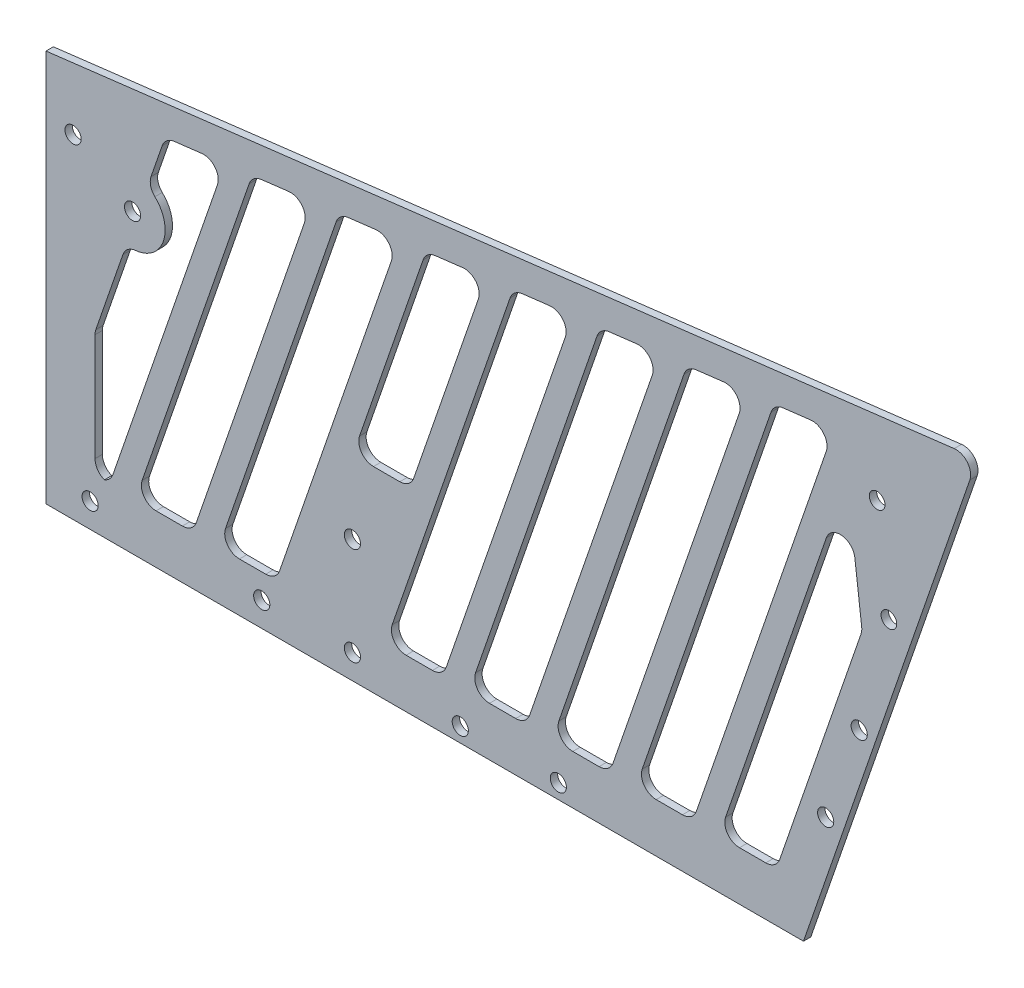
from build123d import *

# Parameters (mm, degrees)
SKETCH_1_R          = 1.65
EXTRUDE_1_DEPTH     = 1.5
SKETCH_2_R          = 1.65
CUT_EXTRUDE_1_DEPTH = 217.113258134
SKETCH_5_R          = 1.6
CUT_EXTRUDE_3_DEPTH = 217.113258134
CUT_EXTRUDE_4_DEPTH = 10
FILLET_3_R          = 3
FILLET_4_R          = 5
SKETCH_7_W          = 17
SKETCH_7_H          = 10
EXTRUDE_2_DEPTH     = 1.5
FILLET_5_R          = 3
FILLET_6_R          = 3


with BuildPart() as part:
    # 草图1 → 凸台-拉伸1 (new body)
    with BuildSketch(Plane.XY):
        Polygon((0, 0), (49, 0), (154.500036, 0), (190, 102.969366032), (0, 80), align=None)
        with Locations((44, 5)):
            Circle(SKETCH_1_R, mode=Mode.SUBTRACT)
        with Locations((9, 5)):
            Circle(SKETCH_1_R, mode=Mode.SUBTRACT)
        with Locations((62.500036, 5)):
            Circle(SKETCH_1_R, mode=Mode.SUBTRACT)
        with Locations((62.500036, 25)):
            Circle(SKETCH_1_R, mode=Mode.SUBTRACT)
        with Locations((84.500036, 3)):
            Circle(SKETCH_1_R, mode=Mode.SUBTRACT)
        with Locations((104.500036, 3)):
            Circle(SKETCH_1_R, mode=Mode.SUBTRACT)
        with Locations((159.029214579, 24.172402674)):
            Circle(SKETCH_1_R, mode=Mode.SUBTRACT)
        with Locations((165.869617446, 42.96625509)):
            Circle(SKETCH_1_R, mode=Mode.SUBTRACT)
        with Locations((5.51669804, 68)):
            Circle(SKETCH_1_R, mode=Mode.SUBTRACT)
    extrude(amount=EXTRUDE_1_DEPTH)

    # 草图2 → 切除-拉伸1 (cut, through all)
    with BuildSketch(Plane(origin=(0, 0, 0), x_dir=(-1, 0, 0), z_dir=(0, 0, -1))):
        with Locations((-17.654838092, 60.522562577)):
            Circle(SKETCH_2_R)
    extrude(amount=-CUT_EXTRUDE_1_DEPTH, mode=Mode.SUBTRACT)

    # 草图5 → 切除-拉伸3 (cut, through all)
    with BuildSketch(Plane.XY.offset(1.5)):
        with Locations((169.526207601, 85.385047705)):
            Circle(SKETCH_5_R)
        with Locations((171.926558982, 65.529612347)):
            Circle(SKETCH_5_R)
    extrude(amount=-CUT_EXTRUDE_3_DEPTH, mode=Mode.SUBTRACT)

    # 草图6 → 切除-拉伸4 (cut)
    with BuildSketch(Plane(origin=(0, 0, 0), x_dir=(-1, 0, 0), z_dir=(0, 0, -1))):
        Polygon((-166.458788313, 60.765712768), (-148.956680209, 10), (-137.24549175, 10), (-163.418370686, 85.91570378), align=None)
        Polygon((-160.704378524, 93.384092174), (-131.956680209, 10), (-120.24549175, 10), (-148.483853144, 91.90673575), align=None)
        Polygon((-142.96502336, 91.23955669), (-114.956680209, 10), (-103.24549175, 10), (-130.74449798, 89.762200266), align=None)
        Polygon((-125.225668197, 89.095021206), (-97.956680209, 10), (-86.24549175, 10), (-113.005142817, 87.617664782), align=None)
        Polygon((-107.486313033, 86.950485723), (-80.956680209, 10), (-69.24549175, 10), (-95.265787653, 85.473129299), align=None)
        with BuildLine():
            Line((-77.526432489, 83.328593815), (-89.746957869, 84.805950239))
            Line((-89.746957869, 84.805950239), (-69.149740199, 25.062722173))
            ThreePointArc((-69.149740199, 25.062722173), (-65.935444688, 30.69389736), (-59.455145067, 30.91194885))
            Line((-59.455145067, 30.91194885), (-77.526432489, 83.328593815))
        make_face()
        with BuildLine():
            Line((-12.956680209, 10), (-10, 10))
            Line((-10, 10), (-10, 35.392875452))
            Line((-10, 35.392875452), (-16.411528112, 53.989823466))
            ThreePointArc((-16.411528112, 53.989823466), (-23.94169474, 58.355090898), (-20.701647581, 66.4335229))
            Line((-20.701647581, 66.4335229), (-24.308366998, 76.894987363))
            Line((-24.308366998, 76.894987363), (-36.528892378, 78.372343787))
            Line((-36.528892378, 78.372343787), (-12.956680209, 10))
        make_face()
        Polygon((-72.007602706, 82.661414755), (-46.956680209, 10), (-35.24549175, 10), (-59.787077326, 81.184058331), align=None)
        Polygon((-29.956680209, 10), (-18.24549175, 10), (-42.047722162, 79.039522847), (-54.268247542, 80.516879271), align=None)
    extrude(amount=-CUT_EXTRUDE_4_DEPTH, mode=Mode.SUBTRACT)

    # 圆角3
    # the kernel refuses this fillet: 3 mm, written as the material it adds along each edge
    with BuildSketch(Plane(origin=(89.746957869, 84.805950239, 0), x_dir=(-0.32593559085415924, -0.9453919772319576, 0), z_dir=(0, 0, 1)), Plane(origin=(107.486313033, 86.950485723, 0), x_dir=(-0.32593559085416013, -0.9453919772319572, 0), z_dir=(0, 0, 1)), Plane(origin=(54.268247542, 80.516879271, 0), x_dir=(-0.32593559085415885, -0.9453919772319577, 0), z_dir=(0, 0, 1)), Plane(origin=(125.225668197, 89.095021206, 0), x_dir=(-0.32593559085416013, -0.9453919772319572, 0), z_dir=(0, 0, 1)), Plane(origin=(142.96502336, 91.23955669, 0), x_dir=(-0.3259355908541637, -0.945391977231956, 0), z_dir=(0, 0, 1)), Plane(origin=(36.528892378, 78.372343787, 0), x_dir=(-0.32593559085416013, -0.9453919772319572, 0), z_dir=(0, 0, 1))) as fillet_3_piece_1:
        with BuildLine():
            CenterArc((FILLET_3_R * 1.59770807733, -FILLET_3_R), FILLET_3_R, 90, 115.915383649)
            Line((FILLET_3_R * 0.698267610033, -FILLET_3_R * 1.43704329967), (0, 0))
            Line((0, 0), (FILLET_3_R * 1.59770807733, 0))
        make_face()
    extrude(amount=1.5)
    with BuildSketch(Plane(origin=(77.526432489, 83.328593815, 0), x_dir=(-0.32593559085416024, -0.9453919772319572, 0), z_dir=(0, 0, 1))) as fillet_3_piece_2:
        with BuildLine():
            CenterArc((FILLET_3_R * 0.625896566582, FILLET_3_R), FILLET_3_R, 205.915383649, 64.084616351)
            Line((-FILLET_3_R * 0.273543900714, FILLET_3_R * 0.562956700325), (0, 0))
            Line((0, 0), (FILLET_3_R * 0.625896566582, 0))
        make_face()
    extrude(amount=1.5)
    with BuildSketch(Plane(origin=(95.265787653, 85.473129299, 0), x_dir=(0.9927717678876198, 0.12001756906924078, 0), z_dir=(0, 0, 1)), Plane(origin=(42.047722162, 79.039522847, 0), x_dir=(0.9927717678876197, 0.12001756906924214, 0), z_dir=(0, 0, 1)), Plane(origin=(59.787077326, 81.184058331, 0), x_dir=(0.9927717678876204, 0.12001756906923514, 0), z_dir=(0, 0, 1)), Plane(origin=(148.483853144, 91.90673575, 0), x_dir=(0.9927717678876198, 0.12001756906924078, 0), z_dir=(0, 0, 1)), Plane(origin=(113.005142817, 87.617664782, 0), x_dir=(0.9927717678876197, 0.12001756906924169, 0), z_dir=(0, 0, 1)), Plane(origin=(130.74449798, 89.762200266, 0), x_dir=(0.9927717678876193, 0.1200175690692444, 0), z_dir=(0, 0, 1)), Plane(origin=(24.308366998, 76.894987363, 0), x_dir=(0.9927717678876197, 0.12001756906924214, 0), z_dir=(0, 0, 1))) as fillet_3_piece_3:
        with BuildLine():
            CenterArc((FILLET_3_R * 0.625896566582, -FILLET_3_R), FILLET_3_R, 90, 64.084616351)
            Line((-FILLET_3_R * 0.273543900714, -FILLET_3_R * 0.562956700325), (0, 0))
            Line((0, 0), (FILLET_3_R * 0.625896566582, 0))
        make_face()
    extrude(amount=1.5)
    with BuildSketch(Plane(origin=(69.24549175, 10, 0), x_dir=(0.3259355908541607, 0.9453919772319569, 0), z_dir=(0, 0, 1)), Plane(origin=(35.24549175, 10, 0), x_dir=(0.3259355908541611, 0.9453919772319569, 0), z_dir=(0, 0, 1)), Plane(origin=(120.24549175, 10, 0), x_dir=(0.3259355908541582, 0.9453919772319579, 0), z_dir=(0, 0, 1)), Plane(origin=(137.24549175, 10, 0), x_dir=(0.3259355908541602, 0.9453919772319572, 0), z_dir=(0, 0, 1)), Plane(origin=(86.24549175, 10, 0), x_dir=(0.3259355908541607, 0.9453919772319569, 0), z_dir=(0, 0, 1)), Plane(origin=(103.24549175, 10, 0), x_dir=(0.3259355908541607, 0.9453919772319569, 0), z_dir=(0, 0, 1))) as fillet_3_piece_4:
        with BuildLine():
            CenterArc((FILLET_3_R * 1.40252469112, -FILLET_3_R), FILLET_3_R, 90, 109.022267108)
            Line((FILLET_3_R * 0.457132713888, -FILLET_3_R * 1.32593559085), (0, 0))
            Line((0, 0), (FILLET_3_R * 1.40252469112, 0))
        make_face()
    extrude(amount=1.5)
    with BuildSketch(Plane(origin=(80.956680209, 10, 0), x_dir=(0.32593559085415746, 0.9453919772319582, 0), z_dir=(0, 0, 1)), Plane(origin=(97.956680209, 10, 0), x_dir=(0.32593559085415946, 0.9453919772319574, 0), z_dir=(0, 0, 1)), Plane(origin=(114.956680209, 10, 0), x_dir=(0.3259355908541564, 0.9453919772319586, 0), z_dir=(0, 0, 1)), Plane(origin=(12.956680209, 10, 0), x_dir=(0.3259355908541589, 0.9453919772319578, 0), z_dir=(0, 0, 1))) as fillet_3_piece_5:
        with BuildLine():
            CenterArc((FILLET_3_R * 0.7129999253, FILLET_3_R), FILLET_3_R, 199.022267108, 70.977732892)
            Line((-FILLET_3_R * 0.232392051932, FILLET_3_R * 0.674064409146), (0, 0))
            Line((0, 0), (FILLET_3_R * 0.7129999253, 0))
        make_face()
    extrude(amount=1.5)
    with BuildSketch(Plane(origin=(18.24549175, 10, 0), x_dir=(1, 0, 0), z_dir=(0, 0, 1))) as fillet_3_piece_6:
        with BuildLine():
            CenterArc((FILLET_3_R * 1.40252469112, FILLET_3_R), FILLET_3_R, 160.977732892, 109.022267108)
            Line((FILLET_3_R * 0.457132713888, FILLET_3_R * 1.32593559085), (0, 0))
            Line((0, 0), (FILLET_3_R * 1.40252469112, 0))
        make_face()
    extrude(amount=1.5)
    with BuildSketch(Plane(origin=(29.956680209, 10, 0), x_dir=(-1, 0, 0), z_dir=(0, 0, 1)), Plane(origin=(46.956680209, 10, 0), x_dir=(-1, 0, 0), z_dir=(0, 0, 1)), Plane(origin=(131.956680209, 10, 0), x_dir=(-1, 0, 0), z_dir=(0, 0, 1)), Plane(origin=(148.956680209, 10, 0), x_dir=(-1, 0, 0), z_dir=(0, 0, 1))) as fillet_3_piece_7:
        with BuildLine():
            CenterArc((FILLET_3_R * 0.7129999253, -FILLET_3_R), FILLET_3_R, 90, 70.977732892)
            Line((-FILLET_3_R * 0.232392051932, -FILLET_3_R * 0.674064409146), (0, 0))
            Line((0, 0), (FILLET_3_R * 0.7129999253, 0))
        make_face()
    extrude(amount=1.5)
    with BuildSketch(Plane(origin=(72.007602706, 82.661414755, 0), x_dir=(-0.9927717678876198, -0.12001756906924071, 0), z_dir=(0, 0, 1)), Plane(origin=(160.704378524, 93.384092174, 0), x_dir=(-0.9927717678876197, -0.12001756906924108, 0), z_dir=(0, 0, 1))) as fillet_3_piece_8:
        with BuildLine():
            CenterArc((FILLET_3_R * 1.59770807733, FILLET_3_R), FILLET_3_R, 154.084616351, 115.915383649)
            Line((FILLET_3_R * 0.698267610033, FILLET_3_R * 1.43704329967), (0, 0))
            Line((0, 0), (FILLET_3_R * 1.59770807733, 0))
        make_face()
    extrude(amount=1.5)
    with BuildSketch(Plane(origin=(166.458788313, 60.765712768, 0), x_dir=(-0.3259355908541462, -0.9453919772319621, 0), z_dir=(0, 0, 1))) as fillet_3_piece_9:
        with BuildLine():
            CenterArc((FILLET_3_R * 0.230090548875, -FILLET_3_R), FILLET_3_R, 90, 25.915383649)
            Line((-FILLET_3_R * 0.2069527508, -FILLET_3_R * 0.100559532704), (0, 0))
            Line((0, 0), (FILLET_3_R * 0.230090548875, 0))
        make_face()
    extrude(amount=1.5)
    with BuildSketch(Plane(origin=(163.418370686, 85.91570378, 0), x_dir=(-0.3259355908541588, -0.9453919772319578, 0), z_dir=(0, 0, 1))) as fillet_3_piece_10:
        with BuildLine():
            CenterArc((FILLET_3_R * 4.34611506162, FILLET_3_R), FILLET_3_R, 115.915383649, 154.084616351)
            Line((FILLET_3_R * 3.90907176194, FILLET_3_R * 1.8994404673), (0, 0))
            Line((0, 0), (FILLET_3_R * 4.34611506162, 0))
        make_face()
    extrude(amount=1.5)
    with BuildSketch(Plane(origin=(20.701647581, 66.4335229, 0), x_dir=(0.3259355908541343, 0.9453919772319662, 0), z_dir=(0, 0, 1))) as fillet_3_piece_11:
        with BuildLine():
            CenterArc((2.221583802, -3), FILLET_3_R, 90, 65.812499939)
            ThreePointArc((-0.515044774, -1.770827906), (-0.195837699, -0.903354926), (0, 0))
            Line((0, 0), (2.221583802, 0))
        make_face()
    extrude(amount=1.5)
    with BuildSketch(Plane(origin=(16.411528112, 53.989823466, 0), x_dir=(0.9988016907645847, -0.04894060201720955, 0), z_dir=(0, 0, 1))) as fillet_3_piece_12:
        with BuildLine():
            CenterArc((2.260194582, -2.971019192), FILLET_3_R, 97.970443489, 65.812499939)
            Line((-0.620437185, -2.133188292), (0, 0))
            ThreePointArc((0, 0), (0.922103925, -0.064240792), (1.84420785, 0))
        make_face()
    extrude(amount=1.5)
    with BuildSketch(Plane(origin=(10, 35.392875452, 0), x_dir=(0.3259355908541632, 0.9453919772319561, 0), z_dir=(0, 0, 1))) as fillet_3_piece_13:
        with BuildLine():
            CenterArc((FILLET_3_R * 0.167542374323, -FILLET_3_R), FILLET_3_R, 90, 19.022267108)
            Line((-FILLET_3_R * 0.158393216531, -FILLET_3_R * 0.054608022768), (0, 0))
            Line((0, 0), (FILLET_3_R * 0.167542374323, 0))
        make_face()
    extrude(amount=1.5)
    with BuildSketch(Plane(origin=(10, 10, 0), x_dir=(0, 1, 0), z_dir=(0, 0, 1))) as fillet_3_piece_14:
        with BuildLine():
            CenterArc((FILLET_3_R, -FILLET_3_R), FILLET_3_R, 90, 90)
            Line((0, -FILLET_3_R), (0, 0))
            Line((0, 0), (FILLET_3_R, 0))
        make_face()
    extrude(amount=1.5)

    # 圆角4
    fillet_4_edges = [part.edges().sort_by_distance(p)[0] for p in [
        (69.149740199, 25.062722173, 0.75),
    ]]
    fillet(fillet_4_edges, radius=FILLET_4_R)

    # 草图7 → 凸台-拉伸2 (add)
    with BuildSketch(Plane.XY.offset(1.5)):
        with Locations((67.640739409, 35)):
            Rectangle(SKETCH_7_W, SKETCH_7_H)
    extrude(amount=-EXTRUDE_2_DEPTH)

    # 圆角5
    fillet_5_edges = [part.edges().sort_by_distance(p)[0] for p in [
        (62.588363238, 40, 0.75),
        (74.299551697, 40, 0.75),
    ]]
    fillet(fillet_5_edges, radius=FILLET_5_R)

    # 圆角6
    fillet_6_edges = [part.edges().sort_by_distance(p)[0] for p in [
        (190, 102.969366032, 0.75),
    ]]
    fillet(fillet_6_edges, radius=FILLET_6_R)


solid = part.part
